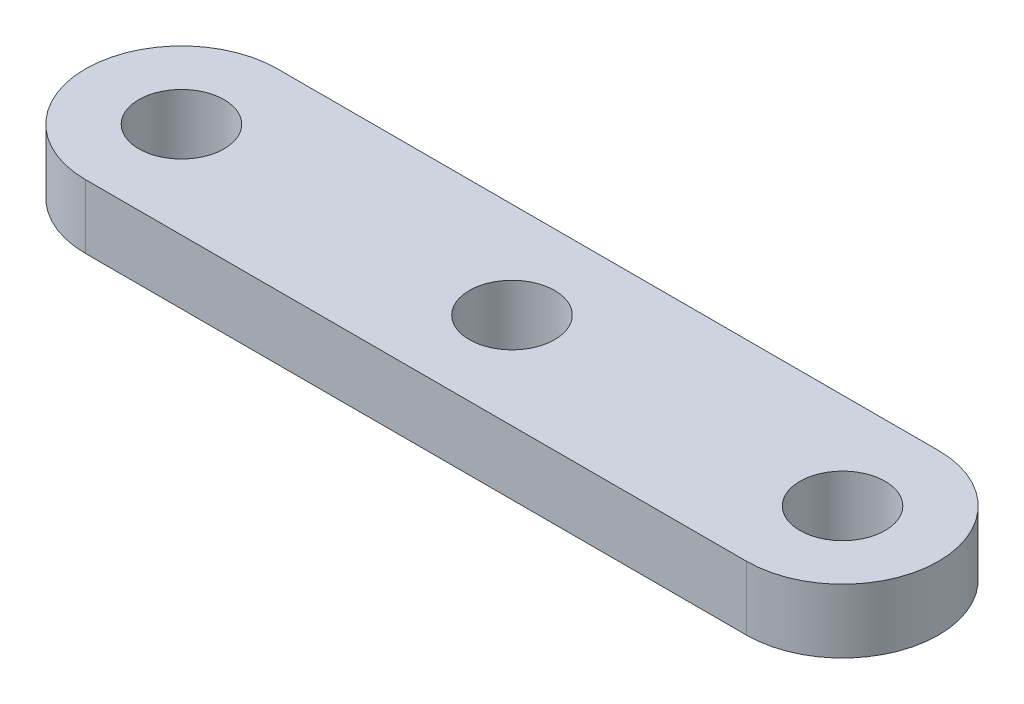
from build123d import *

# Parameters (mm, degrees)
BOSS_EXTRUDE1_DEPTH = 6
SKETCH3_R           = 4
CUT_EXTRUDE1_DEPTH  = 6


with BuildPart() as part:
    # Sketch2 → Boss-Extrude1 (new body)
    with BuildSketch(Plane(origin=(0, 0, 0), x_dir=(1, 0, 0), z_dir=(0, 1, 0))):
        with BuildLine():
            Line((0, 0), (62, 0))
            ThreePointArc((62, 0), (71, 9), (62, 18))
            Line((62, 18), (0, 18))
            ThreePointArc((0, 18), (-9, 9), (0, 0))
        make_face()
    extrude(amount=BOSS_EXTRUDE1_DEPTH)

    # Sketch3 → Cut-Extrude1 (cut)
    with BuildSketch(Plane.XZ):
        with Locations((0, -9)):
            Circle(SKETCH3_R)
        with Locations((31, -9)):
            Circle(SKETCH3_R)
        with Locations((62, -9)):
            Circle(SKETCH3_R)
    extrude(amount=-CUT_EXTRUDE1_DEPTH, mode=Mode.SUBTRACT)


solid = part.part
